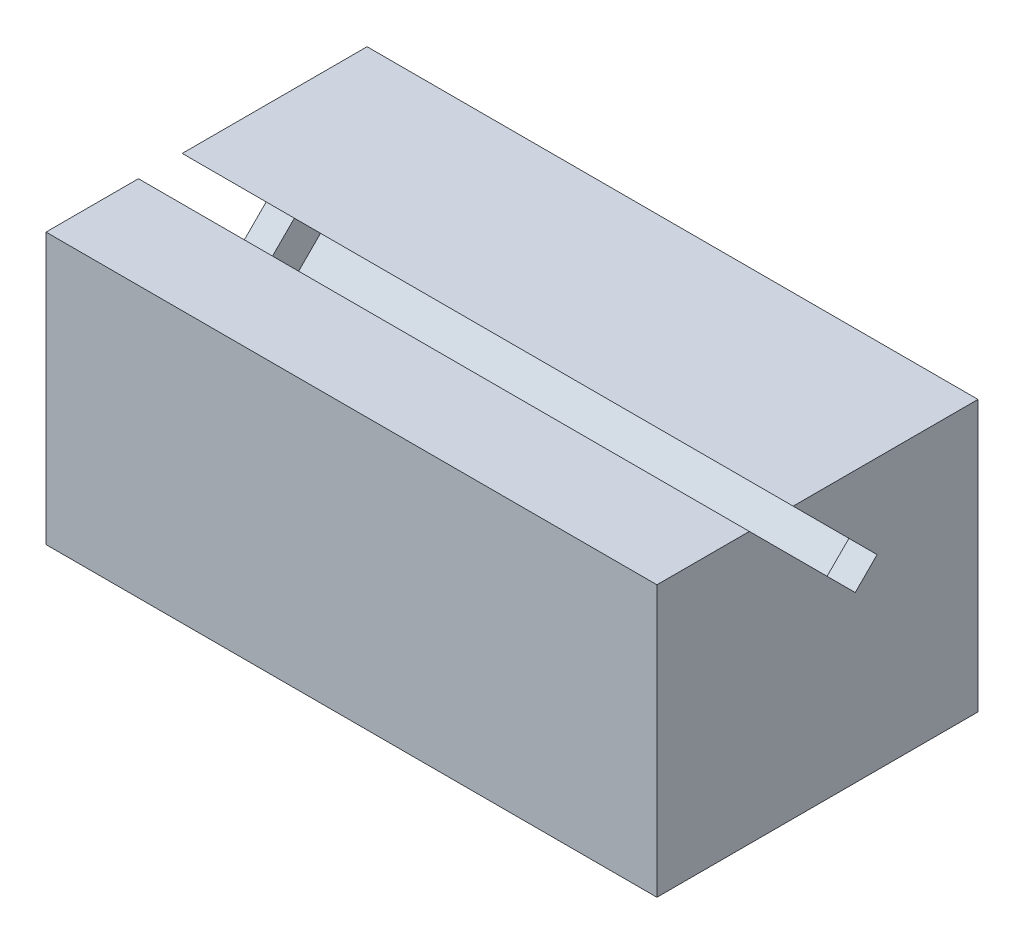
from build123d import *

# Parameters (mm, degrees)
BOSS_EXTRUDE1_DEPTH = 66.1
BOSS_EXTRUDE2_DEPTH = 3.05


with BuildPart() as part:
    # Sketch1 → Boss-Extrude1 (new body)
    with BuildSketch(Plane(origin=(0, 0, 0), x_dir=(0, 0, -1), z_dir=(1, 0, 0))):
        Polygon((0, 29.28355698), (0, 0), (34.737615434, 0), (34.737615434, 29.28355698), (14.737615434, 29.28355698), (23.823937572, 20.197234842), (26.652364697, 17.368807717), (24.28355698, 15), (21.455129855, 17.828427125), (10, 29.28355698), align=None)
    extrude(amount=BOSS_EXTRUDE1_DEPTH)

    # Sketch1<4> → Boss-Extrude2 (add)
    with BuildSketch(Plane(origin=(0, 0, 0), x_dir=(0, 0, -1), z_dir=(1, 0, 0))):
        Polygon((23.823937572, 20.197234842), (21.455129855, 17.828427125), (24.28355698, 15), (26.652364697, 17.368807717), align=None)
    boss_extrude2 = extrude(amount=BOSS_EXTRUDE2_DEPTH)

    # Mirror1: Boss-Extrude2 across plane
    add(boss_extrude2.mirror(Plane.ZY.offset(-33.05)))


solid = part.part
